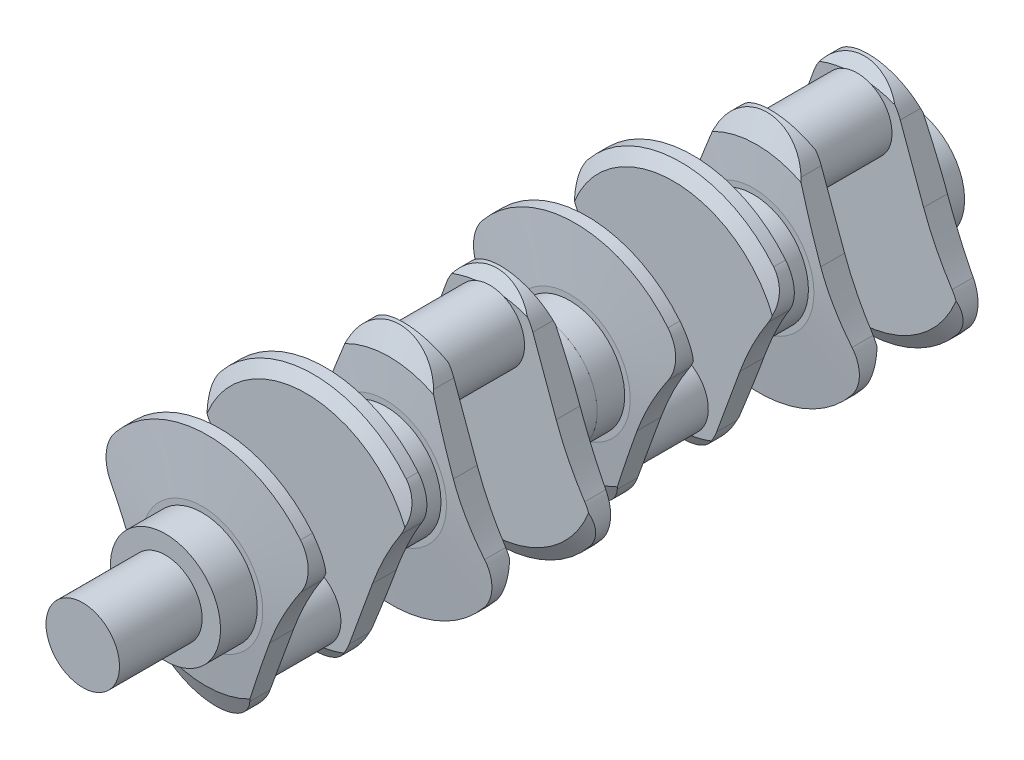
from build123d import *

# Parameters (mm, degrees)
SKETCH1_W                    = 1651
SKETCH1_H                    = 190.5
SKETCH2_R                    = 762
BOSS_EXTRUDE1_DEPTH          = 381
SKETCH3_R                    = 482.6
BOSS_EXTRUDE2_DEPTH          = 698.5
CUT_EXTRUDE1_DEPTH           = 508
BOSS_EXTRUDE3_START          = 152.4
BOSS_EXTRUDE3_DEPTH          = 152.4
CUT_REVOLVE1_ANGLE           = 90
CUT_REVOLVE1_OTHER_WAY_ANGLE = 90
BODY_MOVE_COPY2_ANGLE        = 180
BODY_MOVE_COPY3_ANGLE        = 180
SKETCH8_R                    = 762
BOSS_EXTRUDE4_DEPTH          = 127
SKETCH9_R                    = 508
BOSS_EXTRUDE5_DEPTH          = 1270
CUT_EXTRUDE2_START           = -127
SKETCH11_R                   = 762
CUT_EXTRUDE2_DEPTH           = 127
SKETCH12_R                   = 762
BOSS_EXTRUDE6_DEPTH          = 127


with BuildPart() as part:
    # Sketch1 → Revolve2 (revolve)
    with BuildSketch(Plane(origin=(0, 0, 0), x_dir=(1, 0, 0), z_dir=(0, 1, 0)), mode=Mode.PRIVATE) as revolve2_sk:
        with Locations((-825.5, 95.25)):
            Rectangle(SKETCH1_W, SKETCH1_H)
    revolve(revolve2_sk.sketch.rotate(Axis((0, 0, 0), (0, 0, -1)), 180), axis=Axis((0, 0, 0), (0, 0, -1)))

    # Sketch2 → Boss-Extrude1 (add)
    with BuildSketch(Plane.XY):
        Circle(SKETCH2_R)
    extrude(amount=BOSS_EXTRUDE1_DEPTH)

    # Sketch3 → Boss-Extrude2 (add)
    with BuildSketch(Plane(origin=(0, 0, -190.5), x_dir=(-1, 0, 0), z_dir=(0, 0, -1))):
        with Locations((0, 1016)):
            Circle(SKETCH3_R)
    extrude(amount=BOSS_EXTRUDE2_DEPTH)

    # Sketch4 → Cut-Extrude1 (cut)
    with BuildSketch(Plane(origin=(0, 0, -190.5), x_dir=(-1, 0, 0), z_dir=(0, 0, -1))):
        with BuildLine():
            ThreePointArc((-6.396e-06, 1651), (364.221034463, 1536.161549958), (596.704814199, 1233.182791012))
            Line((596.704814199, 1233.182791012), (919.300798487, 346.857608574))
            ThreePointArc((919.300798487, 346.857608574), (1093.74646777, -57.892443583), (1313.76819808, -439.788155058))
            ThreePointArc((1313.76819808, -439.788155058), (1396.376280788, -743.586134794), (1284.111111111, -1037.718485101))
            ThreePointArc((1284.111111111, -1037.718485101), (1556.577727652, -550.333333333), (1651, 0))
            ThreePointArc((1651, 0), (1167.433293478, 1167.433298), (-6.396e-06, 1651))
        make_face()
        with BuildLine():
            ThreePointArc((-596.704814199, 1233.182791012), (-364.221039702, 1536.161546289), (-6.396e-06, 1651))
            ThreePointArc((-6.396e-06, 1651), (-1489.811099958, 711.522231868), (-1284.111111111, -1037.718485101))
            ThreePointArc((-1284.111111111, -1037.718485101), (-1396.376280788, -743.586134794), (-1313.76819808, -439.788155058))
            ThreePointArc((-1313.76819808, -439.788155058), (-1093.74646777, -57.892443583), (-919.300798487, 346.857608574))
            Line((-919.300798487, 346.857608574), (-596.704814199, 1233.182791012))
        make_face()
    extrude(amount=-CUT_EXTRUDE1_DEPTH, mode=Mode.SUBTRACT)

    # Sketch4<5> → Boss-Extrude3 (add)
    with BuildSketch(Plane(origin=(0, 0, -190.5), x_dir=(-1, 0, 0), z_dir=(0, 0, -1)).offset(BOSS_EXTRUDE3_START)):
        with BuildLine():
            Line((919.300798487, 346.857608574), (596.704814199, 1233.182791012))
            ThreePointArc((596.704814199, 1233.182791012), (364.221034463, 1536.161549958), (-6.396e-06, 1651))
            ThreePointArc((-6.396e-06, 1651), (-364.221039702, 1536.161546289), (-596.704814199, 1233.182791012))
            Line((-596.704814199, 1233.182791012), (-919.300798487, 346.857608574))
            ThreePointArc((-919.300798487, 346.857608574), (-1093.74646777, -57.892443583), (-1313.76819808, -439.788155058))
            ThreePointArc((-1313.76819808, -439.788155058), (-1396.376280788, -743.586134794), (-1284.111111111, -1037.718485101))
            ThreePointArc((-1284.111111111, -1037.718485101), (0, -1651), (1284.111111111, -1037.718485101))
            ThreePointArc((1284.111111111, -1037.718485101), (1396.376280788, -743.586134794), (1313.76819808, -439.788155058))
            ThreePointArc((1313.76819808, -439.788155058), (1093.74646777, -57.892443583), (919.300798487, 346.857608574))
        make_face()
    extrude(amount=-BOSS_EXTRUDE3_DEPTH)

    # Sketch5 → Cut-Revolve1 (revolve, cut)
    with BuildSketch(Plane(origin=(0, 0, 0), x_dir=(0, 0, -1), z_dir=(1, 0, 0))):
        Polygon((0, 1233.182791012), (0, 1651), (190.5, 1651), align=None)
    revolve(axis=Axis((0, 0, 381), (0, 0, -1)), revolution_arc=CUT_REVOLVE1_ANGLE, mode=Mode.SUBTRACT)

    # Sketch5 → Cut-Revolve1 other way (revolve, cut)
    with BuildSketch(Plane(origin=(0, 0, 0), x_dir=(0, 0, -1), z_dir=(1, 0, 0))):
        Polygon((0, 1233.182791012), (0, 1651), (190.5, 1651), align=None)
    revolve(axis=Axis((0, 0, 381), (0, 0, 1)), revolution_arc=CUT_REVOLVE1_OTHER_WAY_ANGLE, mode=Mode.SUBTRACT)

    # Sketch6 → Cut-Revolve2 (revolve, cut)
    with BuildSketch(Plane(origin=(0, 0, 0), x_dir=(0, 0, -1), z_dir=(1, 0, 0)), mode=Mode.PRIVATE) as cut_revolve2_sk:
        Polygon((0, -838.2), (0, -1651), (76.2, -1651), align=None)
    revolve(cut_revolve2_sk.sketch.rotate(Axis((0, 0, 381), (0, 0, -1)), 71.491863429), axis=Axis((0, 0, 381), (0, 0, -1)), mode=Mode.SUBTRACT)

    # Sketch7 → Cut-Revolve3 (revolve, cut)
    with BuildSketch(Plane(origin=(0, 0, 0), x_dir=(0, 0, -1), z_dir=(1, 0, 0))):
        Polygon((241.3, -1651), (342.9, -1651), (342.9, -1473.2), align=None)
    revolve(axis=Axis((0, 0, -342.9), (0, 0, 1)), mode=Mode.SUBTRACT)

    # Mirror1: part across plane


with BuildPart() as part_1:
    add(part.part)
    add(part.part.mirror(Plane(origin=(0, 1016, -889), x_dir=(1, 0, 0), z_dir=(0, 0, -1))))


with BuildPart() as body_2:
    # Body-Move/Copy1: read off the stored shape, not the designer's step
    # Body-Move/Copy1: copy of part
    add(part_1.part.moved(Location((0, 0, 5080))))


with BuildPart() as body_3:
    # Body-Move_Copy1 2: copy of part
    add(part_1.part.moved(Location((0, 0, 7620))))


with BuildPart() as body_4:
    # Body-Move_Copy1 3: copy of part
    add(part_1.part.moved(Location((0, 0, 2540))))


with BuildPart() as body_4_1:
    # Body-Move/Copy2: moved
    add(body_4.part.rotate(Axis((0, 0, 0), (0, 0, 1)), BODY_MOVE_COPY2_ANGLE))


with BuildPart() as body_3_1:
    # Body-Move/Copy3: moved
    add(body_3.part.rotate(Axis((0, 0, 0), (0, 0, 1)), BODY_MOVE_COPY3_ANGLE))

    # Sketch9 → Boss-Extrude5 (add)
    with BuildSketch(Plane.XY.offset(8001)):
        with Locations(Location((0, 0, 0), (0, 0, 180))):
            Circle(SKETCH9_R)
    extrude(amount=BOSS_EXTRUDE5_DEPTH)

    # Sketch12 → Boss-Extrude6 (add)
    with BuildSketch(Plane.XY.offset(8001)):
        Circle(SKETCH12_R)
    extrude(amount=BOSS_EXTRUDE6_DEPTH)


with BuildPart() as part_2:
    add(part_1.part)

    # Sketch8 → Boss-Extrude4 (add)
    with BuildSketch(Plane(origin=(0, 0, -2159), x_dir=(-1, 0, 0), z_dir=(0, 0, -1))):
        Circle(SKETCH8_R)
    extrude(amount=BOSS_EXTRUDE4_DEPTH)

    # Sketch11 → Cut-Extrude2 (cut)
    with BuildSketch(Plane(origin=(0, 0, -2286), x_dir=(-1, 0, 0), z_dir=(0, 0, -1)).offset(CUT_EXTRUDE2_START)):
        Circle(SKETCH11_R)
    extrude(amount=CUT_EXTRUDE2_DEPTH, mode=Mode.SUBTRACT)


solid = Compound([body_2.part, body_4_1.part, body_3_1.part, part_2.part])
